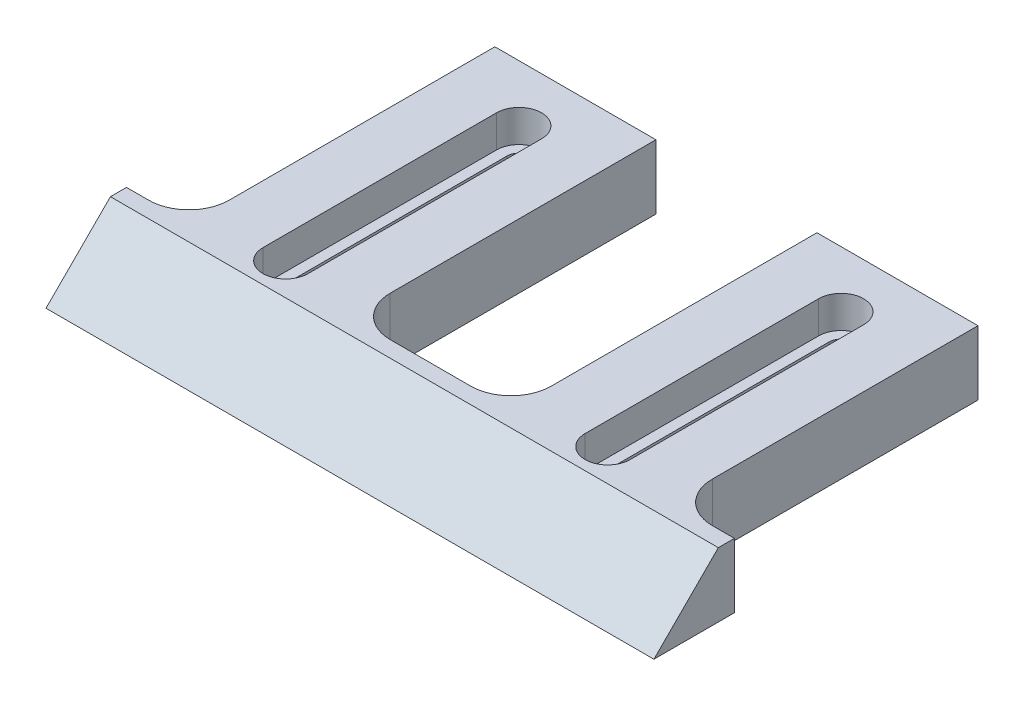
from build123d import *

# Parameters (mm, degrees)
BOSS_EXTRUDE1_DEPTH = 8
CUT_EXTRUDE2_REACH  = 92.908
SKETCH5_W           = 20
SKETCH5_H           = 38
SKETCH5_W_2         = 7.75
CUT_EXTRUDE3_DEPTH  = 10
FILLET1_R           = 5
CHAMFER1_SIZE       = 10
CUT_EXTRUDE4_DEPTH  = 4


with BuildPart() as part:
    # Sketch1 → Boss-Extrude1 (new body)
    with BuildSketch(Plane(origin=(0, 0, 0), x_dir=(1, 0, 0), z_dir=(0, 1, 0))):
        Polygon((0, 0), (0, 50), (75.5, 50), (75.5, 0), (37.75, 0), align=None)
    extrude(amount=BOSS_EXTRUDE1_DEPTH)

    # Sketch4 → Cut-Extrude2 (cut, up to next)
    with BuildSketch(Plane(origin=(0, 8, 0), x_dir=(1, 0, 0), z_dir=(0, 1, 0)), mode=Mode.PRIVATE) as cut_extrude2_sk1:
        with BuildLine():
            Line((19.25, 43), (19.25, 14))
            ThreePointArc((19.25, 14), (17.75, 12.5), (16.25, 14))
            Line((16.25, 14), (16.25, 43))
            ThreePointArc((16.25, 43), (17.75, 44.5), (19.25, 43))
        make_face()
    cut_extrude2_tool1 = extrude(cut_extrude2_sk1.sketch, amount=-CUT_EXTRUDE2_REACH, mode=Mode.PRIVATE) & part.part
    # Sketch4 → Cut-Extrude2 (cut, up to next)
    with BuildSketch(Plane(origin=(0, 8, 0), x_dir=(1, 0, 0), z_dir=(0, 1, 0)), mode=Mode.PRIVATE) as cut_extrude2_sk2:
        with BuildLine():
            Line((59.25, 43), (59.25, 14))
            ThreePointArc((59.25, 14), (57.75, 12.5), (56.25, 14))
            Line((56.25, 14), (56.25, 43))
            ThreePointArc((56.25, 43), (57.75, 44.5), (59.25, 43))
        make_face()
    cut_extrude2_tool2 = extrude(cut_extrude2_sk2.sketch, amount=-CUT_EXTRUDE2_REACH, mode=Mode.PRIVATE) & part.part
    add(cut_extrude2_tool1.solids().sort_by_distance((17.75, 8, -28.5))[0], mode=Mode.SUBTRACT)
    add(cut_extrude2_tool2.solids().sort_by_distance((57.75, 8, -28.5))[0], mode=Mode.SUBTRACT)

    # Sketch5 → Cut-Extrude3 (cut)
    with BuildSketch(Plane(origin=(0, 8, 0), x_dir=(1, 0, 0), z_dir=(0, 1, 0))):
        with Locations((37.75, 31)):
            Rectangle(SKETCH5_W, SKETCH5_H)
        with Locations((71.625, 31)):
            Rectangle(SKETCH5_W_2, SKETCH5_H)
        with Locations((3.875, 31)):
            Rectangle(SKETCH5_W_2, SKETCH5_H)
    extrude(amount=-CUT_EXTRUDE3_DEPTH, mode=Mode.SUBTRACT)

    # Fillet1
    fillet1_edges = [part.edges().sort_by_distance(p)[0] for p in [
        (27.75, 4, -12),
        (47.75, 4, -12),
        (7.75, 4, -12),
        (67.75, 4, -12),
    ]]
    fillet(fillet1_edges, radius=FILLET1_R)

    # Chamfer1
    # the kernel refuses this chamfer: 10 mm, written as the material it takes off along each edge
    with BuildSketch(Plane(origin=(101.21682988, 8, 0), x_dir=(0, -0.9996219169112968, 0.027495876610586372), z_dir=(-1, 0, 0))) as chamfer1_piece_1:
        Polygon((CHAMFER1_SIZE * 0.999621916911, -CHAMFER1_SIZE * 0.0274958766106), (-CHAMFER1_SIZE * 0.0274958766106, -CHAMFER1_SIZE * 0.999621916911), (0, 0), align=None)
    extrude(amount=126.933659759, mode=Mode.SUBTRACT)

    # Sketch7 → Cut-Extrude4 (cut)
    with BuildSketch(Plane(origin=(0, 8, 0), x_dir=(1, 0, 0), z_dir=(0, 1, 0))):
        with BuildLine():
            Line((20.55, 43), (20.55, 14))
            ThreePointArc((20.55, 14), (17.75, 11.2), (14.95, 14))
            Line((14.95, 14), (14.95, 43))
            ThreePointArc((14.95, 43), (17.75, 45.8), (20.55, 43))
        make_face()
        with BuildLine():
            Line((60.55, 43), (60.55, 14))
            ThreePointArc((60.55, 14), (57.75, 11.2), (54.95, 14))
            Line((54.95, 14), (54.95, 43))
            ThreePointArc((54.95, 43), (57.75, 45.8), (60.55, 43))
        make_face()
    extrude(amount=-CUT_EXTRUDE4_DEPTH, mode=Mode.SUBTRACT)


solid = part.part
